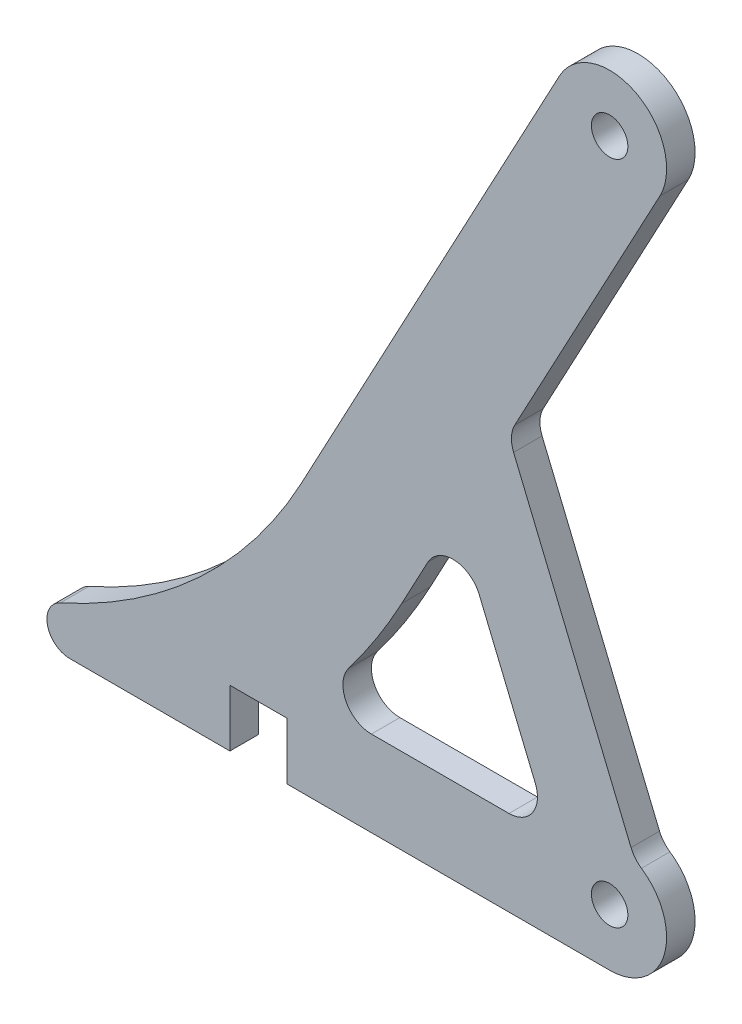
from build123d import *

# Parameters (mm, degrees)
BOSS_EXTRUDE1_DEPTH = 3.175
FILLET1_R           = 2.54
FILLET2_R           = 6.35
SKETCH2_R           = 2.032
CUT_EXTRUDE1_DEPTH  = 112.04109326
CUT_EXTRUDE2_DEPTH  = 112.04109326
FILLET3_R           = 3.175
SKETCH4_W           = 6.35
SKETCH4_H           = 6.35
CUT_EXTRUDE3_DEPTH  = 112.04109326


with BuildPart() as part:
    # Sketch1 → Boss-Extrude1 (new body)
    with BuildSketch(Plane.XY):
        with BuildLine():
            Line((0, 0), (0, 105.836053163))
            Line((0, 105.836053163), (-40.722528328, 29.813690048))
            ThreePointArc((-40.722528328, 29.813690048), (-60.806791576, 8.435812275), (-88.9, 0))
            Line((-88.9, 0), (0, 0))
        make_face()
    extrude(amount=BOSS_EXTRUDE1_DEPTH)

    # Fillet1
    fillet1_edges = [part.edges().sort_by_distance(p)[0] for p in [
        (-88.9, 0, 1.5875),
    ]]
    fillet(fillet1_edges, radius=FILLET1_R)

    # Fillet2
    fillet2_edges = [part.edges().sort_by_distance(p)[0] for p in [
        (0, 0, 1.5875),
        (0, 105.836053163, 1.5875),
    ]]
    fillet(fillet2_edges, radius=FILLET2_R)

    # Sketch2 → Cut-Extrude1 (cut, through all)
    with BuildSketch(Plane.XY.offset(3.175)):
        with Locations((-6.35, 6.35)):
            Circle(SKETCH2_R)
        with Locations((-6.35, 80.533591017)):
            Circle(SKETCH2_R)
    extrude(amount=-CUT_EXTRUDE1_DEPTH, mode=Mode.SUBTRACT)

    # Sketch3 → Cut-Extrude2 (cut, through all)
    with BuildSketch(Plane.XY.offset(3.175)):
        with BuildLine():
            Line((-0.752487641, 77.535198882), (-17.630064548, 46.027497057))
            Line((-17.630064548, 46.027497057), (-3.55734397, 12.052944178))
            ThreePointArc((-3.55734397, 12.052944178), (-0.962242313, 9.710739071), (0, 6.35))
            Line((0, 6.35), (0, 80.533591017))
            ThreePointArc((0, 80.533591017), (-0.190994257, 78.98790403), (-0.752487641, 77.535198882))
        make_face()
        with BuildLine():
            Line((-39.70539713, 9.525), (-12.820020914, 9.525))
            Line((-12.820020914, 9.525), (-23.444062383, 35.173705))
            Line((-23.444062383, 35.173705), (-29.52750361, 23.816905779))
            ThreePointArc((-29.52750361, 23.816905779), (-34.161860366, 16.347219391), (-39.70539713, 9.525))
        make_face()
    extrude(amount=-CUT_EXTRUDE2_DEPTH, mode=Mode.SUBTRACT)

    # Fillet3
    fillet3_edges = [part.edges().sort_by_distance(p)[0] for p in [
        (-39.70539713, 9.525, 1.5875),
        (-12.820020914, 9.525, 1.5875),
        (-23.444062383, 35.173705, 1.5875),
        (-17.630064548, 46.027497057, 1.5875),
        (-3.55734397, 12.052944178, 1.5875),
    ]]
    fillet(fillet3_edges, radius=FILLET3_R)

    # Sketch4 → Cut-Extrude3 (cut, through all)
    with BuildSketch(Plane.XY.offset(3.175)):
        with Locations((-45.499577673, 3.175)):
            Rectangle(SKETCH4_W, SKETCH4_H)
    extrude(amount=-CUT_EXTRUDE3_DEPTH, mode=Mode.SUBTRACT)


solid = part.part
